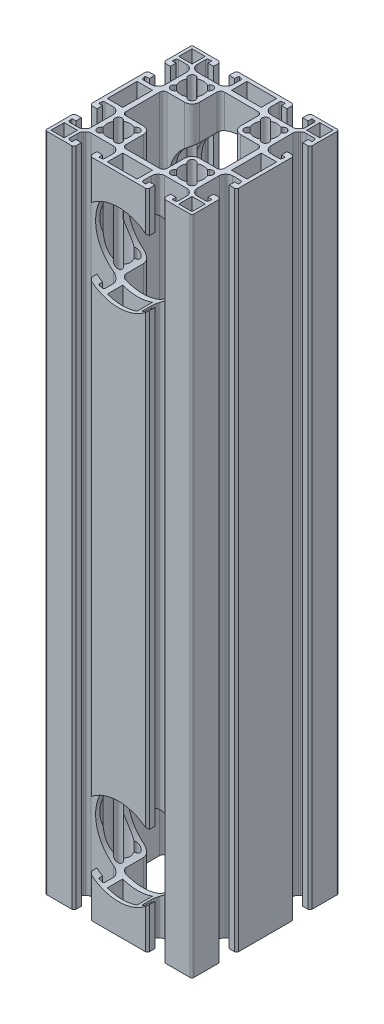
from build123d import *

# Parameters (mm, degrees)
SKETCH1_W           = 8.4
SKETCH1_H           = 16.2
SKETCH1_W_2         = 7.2
SKETCH1_H_2         = 7.2
SKETCH1_W_3         = 16.2
SKETCH1_H_3         = 8.4
BOSS_EXTRUDE1_DEPTH = 360
SKETCH2_R           = 23.7
CUT_EXTRUDE1_DEPTH  = 371.957573711


with BuildPart() as part:
    # Sketch1 → Boss-Extrude1 (new body)
    with BuildSketch(Plane(origin=(0, 0, 0), x_dir=(1, 0, 0), z_dir=(0, 1, 0))):
        with BuildLine():
            Line((39.881157874, -42.704615906), (39.881157874, -28.954615906))
            Line((39.881157874, -28.954615906), (38.881157874, -27.954615906))
            Line((38.881157874, -27.954615906), (35.881157874, -27.954615906))
            Line((35.881157874, -27.954615906), (35.881157874, -30.954615906))
            Line((35.881157874, -30.954615906), (37.485281077, -30.954615906))
            ThreePointArc((37.485281077, -30.954615906), (37.868303299, -31.133222101), (37.977684954, -31.541439995))
            Line((37.977684954, -31.541439995), (37.797926779, -32.560899266))
            ThreePointArc((37.797926779, -32.560899266), (37.49010865, -33.094055905), (36.911599801, -33.304615906))
            Line((36.911599801, -33.304615906), (32.215023493, -33.304615906))
            ThreePointArc((32.215023493, -33.304615906), (31.066973196, -33.076254504), (30.09370315, -32.42593625))
            Line((30.09370315, -32.42593625), (29.55983753, -31.89207063))
            ThreePointArc((29.55983753, -31.89207063), (28.909519276, -30.918800583), (28.681157874, -29.770750286))
            Line((28.681157874, -29.770750286), (28.681157874, -17.638481526))
            ThreePointArc((28.681157874, -17.638481526), (28.909519276, -16.490431229), (29.55983753, -15.517161182))
            Line((29.55983753, -15.517161182), (30.09370315, -14.983295562))
            ThreePointArc((30.09370315, -14.983295562), (31.066973196, -14.332977309), (32.215023493, -14.104615906))
            Line((32.215023493, -14.104615906), (36.911599801, -14.104615906))
            ThreePointArc((36.911599801, -14.104615906), (37.49010865, -14.315175907), (37.797926779, -14.848332546))
            Line((37.797926779, -14.848332546), (37.977684954, -15.867791817))
            ThreePointArc((37.977684954, -15.867791817), (37.868303299, -16.276009711), (37.485281077, -16.454615906))
            Line((37.485281077, -16.454615906), (35.881157874, -16.454615906))
            Line((35.881157874, -16.454615906), (35.881157874, -19.454615906))
            Line((35.881157874, -19.454615906), (38.881157874, -19.454615906))
            Line((38.881157874, -19.454615906), (39.881157874, -18.454615906))
            Line((39.881157874, -18.454615906), (39.881157874, 11.045384094))
            Line((39.881157874, 11.045384094), (38.881157874, 12.045384094))
            Line((38.881157874, 12.045384094), (35.881157874, 12.045384094))
            Line((35.881157874, 12.045384094), (35.881157874, 9.045384094))
            Line((35.881157874, 9.045384094), (37.485281077, 9.045384094))
            ThreePointArc((37.485281077, 9.045384094), (37.868303299, 8.866777899), (37.977684954, 8.458560005))
            Line((37.977684954, 8.458560005), (37.797926779, 7.439100734))
            ThreePointArc((37.797926779, 7.439100734), (37.49010865, 6.905944095), (36.911599801, 6.695384094))
            Line((36.911599801, 6.695384094), (32.215023493, 6.695384094))
            ThreePointArc((32.215023493, 6.695384094), (31.066973196, 6.923745496), (30.09370315, 7.57406375))
            Line((30.09370315, 7.57406375), (29.55983753, 8.10792937))
            ThreePointArc((29.55983753, 8.10792937), (28.909519276, 9.081199417), (28.681157874, 10.229249714))
            Line((28.681157874, 10.229249714), (28.681157874, 22.361518474))
            ThreePointArc((28.681157874, 22.361518474), (28.909519276, 23.509568771), (29.55983753, 24.482838818))
            Line((29.55983753, 24.482838818), (30.09370315, 25.016704438))
            ThreePointArc((30.09370315, 25.016704438), (31.066973196, 25.667022691), (32.215023493, 25.895384094))
            Line((32.215023493, 25.895384094), (36.911599801, 25.895384094))
            ThreePointArc((36.911599801, 25.895384094), (37.49010865, 25.684824093), (37.797926779, 25.151667454))
            Line((37.797926779, 25.151667454), (37.977684954, 24.132208183))
            ThreePointArc((37.977684954, 24.132208183), (37.868303299, 23.723990289), (37.485281077, 23.545384094))
            Line((37.485281077, 23.545384094), (35.881157874, 23.545384094))
            Line((35.881157874, 23.545384094), (35.881157874, 20.545384094))
            Line((35.881157874, 20.545384094), (38.881157874, 20.545384094))
            Line((38.881157874, 20.545384094), (39.881157874, 21.545384094))
            Line((39.881157874, 21.545384094), (39.881157874, 35.295384094))
            ThreePointArc((39.881157874, 35.295384094), (39.588264655, 36.002490875), (38.881157874, 36.295384094))
            Line((38.881157874, 36.295384094), (25.131157874, 36.295384094))
            Line((25.131157874, 36.295384094), (24.131157874, 35.295384094))
            Line((24.131157874, 35.295384094), (24.131157874, 32.295384094))
            Line((24.131157874, 32.295384094), (27.131157874, 32.295384094))
            Line((27.131157874, 32.295384094), (27.131157874, 33.899507298))
            ThreePointArc((27.131157874, 33.899507298), (27.309764069, 34.282529519), (27.717981962, 34.391911174))
            Line((27.717981962, 34.391911174), (28.737441233, 34.212152999))
            ThreePointArc((28.737441233, 34.212152999), (29.270597872, 33.90433487), (29.481157874, 33.325826021))
            Line((29.481157874, 33.325826021), (29.481157874, 28.629249714))
            ThreePointArc((29.481157874, 28.629249714), (29.252796471, 27.481199417), (28.602478217, 26.50792937))
            Line((28.602478217, 26.50792937), (28.068612597, 25.97406375))
            ThreePointArc((28.068612597, 25.97406375), (27.095342551, 25.323745496), (25.947292254, 25.095384094))
            Line((25.947292254, 25.095384094), (13.815023493, 25.095384094))
            ThreePointArc((13.815023493, 25.095384094), (12.666973196, 25.323745496), (11.69370315, 25.97406375))
            Line((11.69370315, 25.97406375), (11.15983753, 26.50792937))
            ThreePointArc((11.15983753, 26.50792937), (10.509519276, 27.481199417), (10.281157874, 28.629249714))
            Line((10.281157874, 28.629249714), (10.281157874, 33.325826021))
            ThreePointArc((10.281157874, 33.325826021), (10.491717875, 33.90433487), (11.024874514, 34.212152999))
            Line((11.024874514, 34.212152999), (12.044333785, 34.391911174))
            ThreePointArc((12.044333785, 34.391911174), (12.452551678, 34.282529519), (12.631157874, 33.899507298))
            Line((12.631157874, 33.899507298), (12.631157874, 32.295384094))
            Line((12.631157874, 32.295384094), (15.631157874, 32.295384094))
            Line((15.631157874, 32.295384094), (15.631157874, 35.295384094))
            Line((15.631157874, 35.295384094), (14.631157874, 36.295384094))
            Line((14.631157874, 36.295384094), (-14.868842126, 36.295384094))
            Line((-14.868842126, 36.295384094), (-15.868842126, 35.295384094))
            Line((-15.868842126, 35.295384094), (-15.868842126, 32.295384094))
            Line((-15.868842126, 32.295384094), (-12.868842126, 32.295384094))
            Line((-12.868842126, 32.295384094), (-12.868842126, 33.899507298))
            ThreePointArc((-12.868842126, 33.899507298), (-12.690235931, 34.282529519), (-12.282018038, 34.391911174))
            Line((-12.282018038, 34.391911174), (-11.262558767, 34.212152999))
            ThreePointArc((-11.262558767, 34.212152999), (-10.729402128, 33.90433487), (-10.518842126, 33.325826021))
            Line((-10.518842126, 33.325826021), (-10.518842126, 28.629249714))
            ThreePointArc((-10.518842126, 28.629249714), (-10.747203529, 27.481199417), (-11.397521783, 26.50792937))
            Line((-11.397521783, 26.50792937), (-11.931387403, 25.97406375))
            ThreePointArc((-11.931387403, 25.97406375), (-12.904657449, 25.323745496), (-14.052707746, 25.095384094))
            Line((-14.052707746, 25.095384094), (-26.184976507, 25.095384094))
            ThreePointArc((-26.184976507, 25.095384094), (-27.333026804, 25.323745496), (-28.30629685, 25.97406375))
            Line((-28.30629685, 25.97406375), (-28.84016247, 26.50792937))
            ThreePointArc((-28.84016247, 26.50792937), (-29.490480724, 27.481199417), (-29.718842126, 28.629249714))
            Line((-29.718842126, 28.629249714), (-29.718842126, 33.325826021))
            ThreePointArc((-29.718842126, 33.325826021), (-29.508282125, 33.90433487), (-28.975125486, 34.212152999))
            Line((-28.975125486, 34.212152999), (-27.955666215, 34.391911174))
            ThreePointArc((-27.955666215, 34.391911174), (-27.547448322, 34.282529519), (-27.368842126, 33.899507298))
            Line((-27.368842126, 33.899507298), (-27.368842126, 32.295384094))
            Line((-27.368842126, 32.295384094), (-24.368842126, 32.295384094))
            Line((-24.368842126, 32.295384094), (-24.368842126, 35.295384094))
            Line((-24.368842126, 35.295384094), (-25.368842126, 36.295384094))
            Line((-25.368842126, 36.295384094), (-39.118842126, 36.295384094))
            ThreePointArc((-39.118842126, 36.295384094), (-39.825948908, 36.002490875), (-40.118842126, 35.295384094))
            Line((-40.118842126, 35.295384094), (-40.118842126, 21.545384094))
            Line((-40.118842126, 21.545384094), (-39.118842126, 20.545384094))
            Line((-39.118842126, 20.545384094), (-36.118842126, 20.545384094))
            Line((-36.118842126, 20.545384094), (-36.118842126, 23.545384094))
            Line((-36.118842126, 23.545384094), (-37.72296533, 23.545384094))
            ThreePointArc((-37.72296533, 23.545384094), (-38.105987552, 23.723990289), (-38.215369207, 24.132208183))
            Line((-38.215369207, 24.132208183), (-38.035611031, 25.151667454))
            ThreePointArc((-38.035611031, 25.151667454), (-37.727792902, 25.684824093), (-37.149284054, 25.895384094))
            Line((-37.149284054, 25.895384094), (-32.452707746, 25.895384094))
            ThreePointArc((-32.452707746, 25.895384094), (-31.304657449, 25.667022691), (-30.331387403, 25.016704438))
            Line((-30.331387403, 25.016704438), (-29.797521783, 24.482838818))
            ThreePointArc((-29.797521783, 24.482838818), (-29.147203529, 23.509568771), (-28.918842126, 22.361518474))
            Line((-28.918842126, 22.361518474), (-28.918842126, 10.229249714))
            ThreePointArc((-28.918842126, 10.229249714), (-29.147203529, 9.081199417), (-29.797521783, 8.10792937))
            Line((-29.797521783, 8.10792937), (-30.331387403, 7.57406375))
            ThreePointArc((-30.331387403, 7.57406375), (-31.304657449, 6.923745496), (-32.452707746, 6.695384094))
            Line((-32.452707746, 6.695384094), (-37.149284054, 6.695384094))
            ThreePointArc((-37.149284054, 6.695384094), (-37.727792902, 6.905944095), (-38.035611031, 7.439100734))
            Line((-38.035611031, 7.439100734), (-38.215369207, 8.458560005))
            ThreePointArc((-38.215369207, 8.458560005), (-38.105987552, 8.866777899), (-37.72296533, 9.045384094))
            Line((-37.72296533, 9.045384094), (-36.118842126, 9.045384094))
            Line((-36.118842126, 9.045384094), (-36.118842126, 12.045384094))
            Line((-36.118842126, 12.045384094), (-39.118842126, 12.045384094))
            Line((-39.118842126, 12.045384094), (-40.118842126, 11.045384094))
            Line((-40.118842126, 11.045384094), (-40.118842126, -18.454615906))
            Line((-40.118842126, -18.454615906), (-39.118842126, -19.454615906))
            Line((-39.118842126, -19.454615906), (-36.118842126, -19.454615906))
            Line((-36.118842126, -19.454615906), (-36.118842126, -16.454615906))
            Line((-36.118842126, -16.454615906), (-37.72296533, -16.454615906))
            ThreePointArc((-37.72296533, -16.454615906), (-38.105987552, -16.276009711), (-38.215369207, -15.867791817))
            Line((-38.215369207, -15.867791817), (-38.035611031, -14.848332546))
            ThreePointArc((-38.035611031, -14.848332546), (-37.727792902, -14.315175907), (-37.149284054, -14.104615906))
            Line((-37.149284054, -14.104615906), (-32.452707746, -14.104615906))
            ThreePointArc((-32.452707746, -14.104615906), (-31.304657449, -14.332977309), (-30.331387403, -14.983295562))
            Line((-30.331387403, -14.983295562), (-29.797521783, -15.517161182))
            ThreePointArc((-29.797521783, -15.517161182), (-29.147203529, -16.490431229), (-28.918842126, -17.638481526))
            Line((-28.918842126, -17.638481526), (-28.918842126, -29.770750286))
            ThreePointArc((-28.918842126, -29.770750286), (-29.147203529, -30.918800583), (-29.797521783, -31.89207063))
            Line((-29.797521783, -31.89207063), (-30.331387403, -32.42593625))
            ThreePointArc((-30.331387403, -32.42593625), (-31.304657449, -33.076254504), (-32.452707746, -33.304615906))
            Line((-32.452707746, -33.304615906), (-37.149284054, -33.304615906))
            ThreePointArc((-37.149284054, -33.304615906), (-37.727792902, -33.094055905), (-38.035611031, -32.560899266))
            Line((-38.035611031, -32.560899266), (-38.215369207, -31.541439995))
            ThreePointArc((-38.215369207, -31.541439995), (-38.105987552, -31.133222101), (-37.72296533, -30.954615906))
            Line((-37.72296533, -30.954615906), (-36.118842126, -30.954615906))
            Line((-36.118842126, -30.954615906), (-36.118842126, -27.954615906))
            Line((-36.118842126, -27.954615906), (-39.118842126, -27.954615906))
            Line((-39.118842126, -27.954615906), (-40.118842126, -28.954615906))
            Line((-40.118842126, -28.954615906), (-40.118842126, -42.704615906))
            ThreePointArc((-40.118842126, -42.704615906), (-39.825948908, -43.411722687), (-39.118842126, -43.704615906))
            Line((-39.118842126, -43.704615906), (-25.368842126, -43.704615906))
            Line((-25.368842126, -43.704615906), (-24.368842126, -42.704615906))
            Line((-24.368842126, -42.704615906), (-24.368842126, -39.704615906))
            Line((-24.368842126, -39.704615906), (-27.368842126, -39.704615906))
            Line((-27.368842126, -39.704615906), (-27.368842126, -41.30873911))
            ThreePointArc((-27.368842126, -41.30873911), (-27.547448322, -41.691761331), (-27.955666215, -41.801142986))
            Line((-27.955666215, -41.801142986), (-28.975125486, -41.621384811))
            ThreePointArc((-28.975125486, -41.621384811), (-29.508282125, -41.313566682), (-29.718842126, -40.735057833))
            Line((-29.718842126, -40.735057833), (-29.718842126, -36.038481526))
            ThreePointArc((-29.718842126, -36.038481526), (-29.490480724, -34.890431229), (-28.84016247, -33.917161182))
            Line((-28.84016247, -33.917161182), (-28.30629685, -33.383295562))
            ThreePointArc((-28.30629685, -33.383295562), (-27.333026804, -32.732977309), (-26.184976507, -32.504615906))
            Line((-26.184976507, -32.504615906), (-14.052707746, -32.504615906))
            ThreePointArc((-14.052707746, -32.504615906), (-12.904657449, -32.732977309), (-11.931387403, -33.383295562))
            Line((-11.931387403, -33.383295562), (-11.397521783, -33.917161182))
            ThreePointArc((-11.397521783, -33.917161182), (-10.747203529, -34.890431229), (-10.518842126, -36.038481526))
            Line((-10.518842126, -36.038481526), (-10.518842126, -40.735057833))
            ThreePointArc((-10.518842126, -40.735057833), (-10.729402128, -41.313566682), (-11.262558767, -41.621384811))
            Line((-11.262558767, -41.621384811), (-12.282018038, -41.801142986))
            ThreePointArc((-12.282018038, -41.801142986), (-12.690235931, -41.691761331), (-12.868842126, -41.30873911))
            Line((-12.868842126, -41.30873911), (-12.868842126, -39.704615906))
            Line((-12.868842126, -39.704615906), (-15.868842126, -39.704615906))
            Line((-15.868842126, -39.704615906), (-15.868842126, -42.704615906))
            Line((-15.868842126, -42.704615906), (-14.868842126, -43.704615906))
            Line((-14.868842126, -43.704615906), (14.631157874, -43.704615906))
            Line((14.631157874, -43.704615906), (15.631157874, -42.704615906))
            Line((15.631157874, -42.704615906), (15.631157874, -39.704615906))
            Line((15.631157874, -39.704615906), (12.631157874, -39.704615906))
            Line((12.631157874, -39.704615906), (12.631157874, -41.30873911))
            ThreePointArc((12.631157874, -41.30873911), (12.452551678, -41.691761331), (12.044333785, -41.801142986))
            Line((12.044333785, -41.801142986), (11.024874514, -41.621384811))
            ThreePointArc((11.024874514, -41.621384811), (10.491717875, -41.313566682), (10.281157874, -40.735057833))
            Line((10.281157874, -40.735057833), (10.281157874, -36.038481526))
            ThreePointArc((10.281157874, -36.038481526), (10.509519276, -34.890431229), (11.15983753, -33.917161182))
            Line((11.15983753, -33.917161182), (11.69370315, -33.383295562))
            ThreePointArc((11.69370315, -33.383295562), (12.666973196, -32.732977309), (13.815023493, -32.504615906))
            Line((13.815023493, -32.504615906), (25.947292254, -32.504615906))
            ThreePointArc((25.947292254, -32.504615906), (27.095342551, -32.732977309), (28.068612597, -33.383295562))
            Line((28.068612597, -33.383295562), (28.602478217, -33.917161182))
            ThreePointArc((28.602478217, -33.917161182), (29.252796471, -34.890431229), (29.481157874, -36.038481526))
            Line((29.481157874, -36.038481526), (29.481157874, -40.735057833))
            ThreePointArc((29.481157874, -40.735057833), (29.270597872, -41.313566682), (28.737441233, -41.621384811))
            Line((28.737441233, -41.621384811), (27.717981962, -41.801142986))
            ThreePointArc((27.717981962, -41.801142986), (27.309764069, -41.691761331), (27.131157874, -41.30873911))
            Line((27.131157874, -41.30873911), (27.131157874, -39.704615906))
            Line((27.131157874, -39.704615906), (24.131157874, -39.704615906))
            Line((24.131157874, -39.704615906), (24.131157874, -42.704615906))
            Line((24.131157874, -42.704615906), (25.131157874, -43.704615906))
            Line((25.131157874, -43.704615906), (38.881157874, -43.704615906))
            ThreePointArc((38.881157874, -43.704615906), (39.588264655, -43.411722687), (39.881157874, -42.704615906))
        make_face()
        with BuildLine():
            Line((16.522400663, 10.108199759), (17.10833788, 10.694136975))
            ThreePointArc((17.10833788, 10.694136975), (19.881157874, 10.045384094), (22.653977867, 10.694136975))
            Line((22.653977867, 10.694136975), (23.239915084, 10.108199759))
            ThreePointArc((23.239915084, 10.108199759), (26.068342209, 10.108199759), (26.068342209, 12.936626883))
            Line((26.068342209, 12.936626883), (25.482404992, 13.5225641))
            ThreePointArc((25.482404992, 13.5225641), (26.131157874, 16.295384094), (25.482404992, 19.068204088))
            Line((25.482404992, 19.068204088), (26.068342209, 19.654141305))
            ThreePointArc((26.068342209, 19.654141305), (26.068342209, 22.482568429), (23.239915084, 22.482568429))
            Line((23.239915084, 22.482568429), (22.653977867, 21.896631212))
            ThreePointArc((22.653977867, 21.896631212), (19.881157874, 22.545384094), (17.10833788, 21.896631212))
            Line((17.10833788, 21.896631212), (16.522400663, 22.482568429))
            ThreePointArc((16.522400663, 22.482568429), (13.693973538, 22.482568429), (13.693973538, 19.654141305))
            Line((13.693973538, 19.654141305), (14.279910755, 19.068204088))
            ThreePointArc((14.279910755, 19.068204088), (13.631157874, 16.295384094), (14.279910755, 13.5225641))
            Line((14.279910755, 13.5225641), (13.693973538, 12.936626883))
            ThreePointArc((13.693973538, 12.936626883), (13.693973538, 10.108199759), (16.522400663, 10.108199759))
        make_face(mode=Mode.SUBTRACT)
        with Locations((-33.918842126, -3.704615906)):
            Rectangle(SKETCH1_W, SKETCH1_H, mode=Mode.SUBTRACT)
        with BuildLine():
            Line((-23.477599337, 10.108199759), (-22.89166212, 10.694136975))
            ThreePointArc((-22.89166212, 10.694136975), (-20.118842126, 10.045384094), (-17.346022133, 10.694136975))
            Line((-17.346022133, 10.694136975), (-16.760084916, 10.108199759))
            ThreePointArc((-16.760084916, 10.108199759), (-13.931657791, 10.108199759), (-13.931657791, 12.936626883))
            Line((-13.931657791, 12.936626883), (-14.517595008, 13.5225641))
            ThreePointArc((-14.517595008, 13.5225641), (-13.868842126, 16.295384094), (-14.517595008, 19.068204088))
            Line((-14.517595008, 19.068204088), (-13.931657791, 19.654141305))
            ThreePointArc((-13.931657791, 19.654141305), (-13.931657791, 22.482568429), (-16.760084916, 22.482568429))
            Line((-16.760084916, 22.482568429), (-17.346022133, 21.896631212))
            ThreePointArc((-17.346022133, 21.896631212), (-20.118842126, 22.545384094), (-22.89166212, 21.896631212))
            Line((-22.89166212, 21.896631212), (-23.477599337, 22.482568429))
            ThreePointArc((-23.477599337, 22.482568429), (-26.306026462, 22.482568429), (-26.306026462, 19.654141305))
            Line((-26.306026462, 19.654141305), (-25.720089245, 19.068204088))
            ThreePointArc((-25.720089245, 19.068204088), (-26.368842126, 16.295384094), (-25.720089245, 13.5225641))
            Line((-25.720089245, 13.5225641), (-26.306026462, 12.936626883))
            ThreePointArc((-26.306026462, 12.936626883), (-26.306026462, 10.108199759), (-23.477599337, 10.108199759))
        make_face(mode=Mode.SUBTRACT)
        with BuildLine():
            Line((23.239915084, -17.517431571), (22.653977867, -18.103368788))
            ThreePointArc((22.653977867, -18.103368788), (19.881157874, -17.454615906), (17.10833788, -18.103368788))
            Line((17.10833788, -18.103368788), (16.522400663, -17.517431571))
            ThreePointArc((16.522400663, -17.517431571), (13.693973538, -17.517431571), (13.693973538, -20.345858695))
            Line((13.693973538, -20.345858695), (14.279910755, -20.931795912))
            ThreePointArc((14.279910755, -20.931795912), (13.631157874, -23.704615906), (14.279910755, -26.4774359))
            Line((14.279910755, -26.4774359), (13.693973538, -27.063373117))
            ThreePointArc((13.693973538, -27.063373117), (13.693973538, -29.891800241), (16.522400663, -29.891800241))
            Line((16.522400663, -29.891800241), (17.10833788, -29.305863025))
            ThreePointArc((17.10833788, -29.305863025), (19.881157874, -29.954615906), (22.653977867, -29.305863025))
            Line((22.653977867, -29.305863025), (23.239915084, -29.891800241))
            ThreePointArc((23.239915084, -29.891800241), (26.068342209, -29.891800241), (26.068342209, -27.063373117))
            Line((26.068342209, -27.063373117), (25.482404992, -26.4774359))
            ThreePointArc((25.482404992, -26.4774359), (26.131157874, -23.704615906), (25.482404992, -20.931795912))
            Line((25.482404992, -20.931795912), (26.068342209, -20.345858695))
            ThreePointArc((26.068342209, -20.345858695), (26.068342209, -17.517431571), (23.239915084, -17.517431571))
        make_face(mode=Mode.SUBTRACT)
        with Locations((-34.918842126, -38.504615906)):
            Rectangle(SKETCH1_W_2, SKETCH1_H_2, mode=Mode.SUBTRACT)
        with BuildLine():
            Line((-16.760084916, -17.517431571), (-17.346022133, -18.103368788))
            ThreePointArc((-17.346022133, -18.103368788), (-20.118842126, -17.454615906), (-22.89166212, -18.103368788))
            Line((-22.89166212, -18.103368788), (-23.477599337, -17.517431571))
            ThreePointArc((-23.477599337, -17.517431571), (-26.306026462, -17.517431571), (-26.306026462, -20.345858695))
            Line((-26.306026462, -20.345858695), (-25.720089245, -20.931795912))
            ThreePointArc((-25.720089245, -20.931795912), (-26.368842126, -23.704615906), (-25.720089245, -26.4774359))
            Line((-25.720089245, -26.4774359), (-26.306026462, -27.063373117))
            ThreePointArc((-26.306026462, -27.063373117), (-26.306026462, -29.891800241), (-23.477599337, -29.891800241))
            Line((-23.477599337, -29.891800241), (-22.89166212, -29.305863025))
            ThreePointArc((-22.89166212, -29.305863025), (-20.118842126, -29.954615906), (-17.346022133, -29.305863025))
            Line((-17.346022133, -29.305863025), (-16.760084916, -29.891800241))
            ThreePointArc((-16.760084916, -29.891800241), (-13.931657791, -29.891800241), (-13.931657791, -27.063373117))
            Line((-13.931657791, -27.063373117), (-14.517595008, -26.4774359))
            ThreePointArc((-14.517595008, -26.4774359), (-13.868842126, -23.704615906), (-14.517595008, -20.931795912))
            Line((-14.517595008, -20.931795912), (-13.931657791, -20.345858695))
            ThreePointArc((-13.931657791, -20.345858695), (-13.931657791, -17.517431571), (-16.760084916, -17.517431571))
        make_face(mode=Mode.SUBTRACT)
        with Locations((-34.918842126, 31.095384094)):
            Rectangle(SKETCH1_W_2, SKETCH1_H_2, mode=Mode.SUBTRACT)
        with Locations((34.681157874, -38.504615906)):
            Rectangle(SKETCH1_W_2, SKETCH1_H_2, mode=Mode.SUBTRACT)
        with Locations((34.681157874, 31.095384094)):
            Rectangle(SKETCH1_W_2, SKETCH1_H_2, mode=Mode.SUBTRACT)
        with Locations((-0.118842126, 30.095384094)):
            Rectangle(SKETCH1_W_3, SKETCH1_H_3, mode=Mode.SUBTRACT)
        with BuildLine():
            Line((11.081157874, -28.504615906), (11.081157874, -18.904615906))
            ThreePointArc((11.081157874, -18.904615906), (12.252730749, -16.076188781), (15.081157874, -14.904615906))
            Line((15.081157874, -14.904615906), (24.681157874, -14.904615906))
            ThreePointArc((24.681157874, -14.904615906), (26.095371436, -14.318829468), (26.681157874, -12.904615906))
            Line((26.681157874, -12.904615906), (26.681157874, 5.495384094))
            ThreePointArc((26.681157874, 5.495384094), (26.095371436, 6.909597656), (24.681157874, 7.495384094))
            Line((24.681157874, 7.495384094), (15.081157874, 7.495384094))
            ThreePointArc((15.081157874, 7.495384094), (12.252730749, 8.666956969), (11.081157874, 11.495384094))
            Line((11.081157874, 11.495384094), (11.081157874, 21.095384094))
            ThreePointArc((11.081157874, 21.095384094), (10.495371436, 22.509597656), (9.081157874, 23.095384094))
            Line((9.081157874, 23.095384094), (-9.318842126, 23.095384094))
            ThreePointArc((-9.318842126, 23.095384094), (-10.733055689, 22.509597656), (-11.318842126, 21.095384094))
            Line((-11.318842126, 21.095384094), (-11.318842126, 11.495384094))
            ThreePointArc((-11.318842126, 11.495384094), (-12.490415002, 8.666956969), (-15.318842126, 7.495384094))
            Line((-15.318842126, 7.495384094), (-24.918842126, 7.495384094))
            ThreePointArc((-24.918842126, 7.495384094), (-26.333055689, 6.909597656), (-26.918842126, 5.495384094))
            Line((-26.918842126, 5.495384094), (-26.918842126, -12.904615906))
            ThreePointArc((-26.918842126, -12.904615906), (-26.333055689, -14.318829468), (-24.918842126, -14.904615906))
            Line((-24.918842126, -14.904615906), (-15.318842126, -14.904615906))
            ThreePointArc((-15.318842126, -14.904615906), (-12.490415002, -16.076188781), (-11.318842126, -18.904615906))
            Line((-11.318842126, -18.904615906), (-11.318842126, -28.504615906))
            ThreePointArc((-11.318842126, -28.504615906), (-10.733055689, -29.918829468), (-9.318842126, -30.504615906))
            Line((-9.318842126, -30.504615906), (9.081157874, -30.504615906))
            ThreePointArc((9.081157874, -30.504615906), (10.495371436, -29.918829468), (11.081157874, -28.504615906))
        make_face(mode=Mode.SUBTRACT)
        with Locations((-0.118842126, -37.504615906)):
            Rectangle(SKETCH1_W_3, SKETCH1_H_3, mode=Mode.SUBTRACT)
        with Locations((33.681157874, -3.704615906)):
            Rectangle(SKETCH1_W, SKETCH1_H, mode=Mode.SUBTRACT)
    extrude(amount=BOSS_EXTRUDE1_DEPTH)

    # Sketch2 → Cut-Extrude1 (cut, through all)
    with BuildSketch(Plane(origin=(0, 0, -36.295384094), x_dir=(-1, 0, 0), z_dir=(0, 0, -1))):
        with Locations(Location((0.118842126, 320, 0), (0, 0, 311.648345702))):
            Circle(SKETCH2_R)
        with Locations(Location((0.118842126, 40, 0), (0, 0, 311.648345702))):
            Circle(SKETCH2_R)
    extrude(amount=-CUT_EXTRUDE1_DEPTH, mode=Mode.SUBTRACT)


solid = part.part
